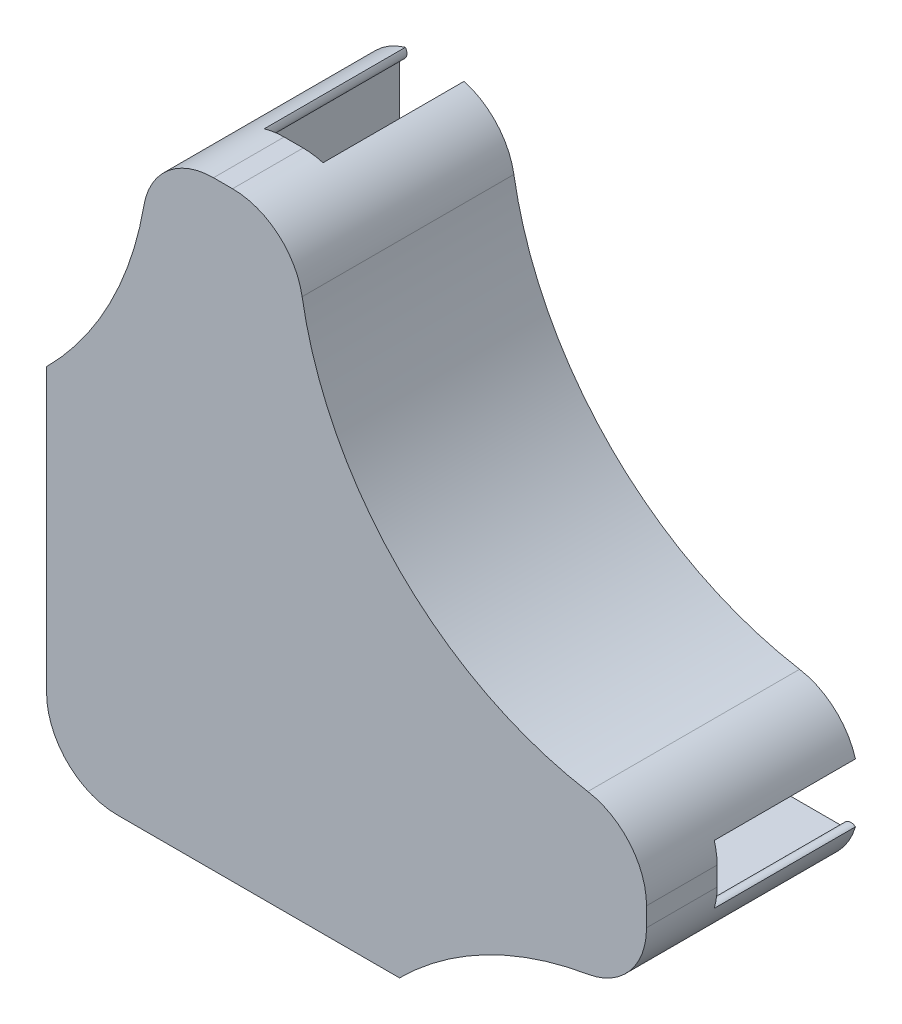
from build123d import *
from build123d.topology import SkipClean

# Parameters (mm, degrees)
BOSS_EXTRUDE1_DEPTH  = 19.05
CUT_EXTRUDE1_DEPTH   = 12.7
MIRROR2_COPY_1_DEPTH = 12.7
SKETCH6_W            = 6.35
SKETCH6_H            = 32.8168
SKETCH6_W_2          = 32.8168
SKETCH6_H_2          = 6.35
CUT_EXTRUDE2_DEPTH   = 12.7
SKETCH7_R            = 0.675
BOSS_EXTRUDE2_DEPTH  = 12.7
FILLET2_DEPTH        = 20
CUT_EXTRUDE3_DEPTH   = 12.7


with BuildPart() as part:
    # Sketch5 → Boss-Extrude1 (new body)
    with BuildSketch(Plane.XY):
        with BuildLine():
            Line((-15.875, 15.875), (-15.875, -15.875))
            Line((-15.875, -15.875), (15.875, -15.875))
            ThreePointArc((15.875, -15.875), (26.071916674, -9.061638106), (38.1, -6.669103576))
            Line((38.1, -6.669103576), (38.1, 6.669103576))
            ThreePointArc((38.1, 6.669103576), (15.875, 15.875), (6.669103576, 38.1))
            Line((6.669103576, 38.1), (-6.669103576, 38.1))
            ThreePointArc((-6.669103576, 38.1), (-9.061638106, 26.071916674), (-15.875, 15.875))
        make_face()
    extrude(amount=BOSS_EXTRUDE1_DEPTH)

    # Sketch4 → Cut-Extrude1 (cut)
    with BuildSketch(Plane.XY):
        with BuildLine():
            Line((4.190365, -12.7), (10.11729625, -12.7))
            Line((10.11729625, -12.7), (12.7, -12.7))
            Line((12.7, -12.7), (12.7, -10.11729625))
            Line((12.7, -10.11729625), (12.7, -4.190365))
            Line((12.7, -4.190365), (12.7, -2.6162))
            Line((12.7, -2.6162), (11.760835, -2.6162))
            Line((11.760835, -2.6162), (11.429365, -2.6162))
            Line((11.429365, -2.6162), (9.8552, -2.6162))
            Line((9.8552, -2.6162), (9.8552, -4.190365))
            Line((9.8552, -4.190365), (9.8552, -6.348478019))
            ThreePointArc((9.8552, -6.348478019), (9.587703162, -6.748815328), (9.115473107, -6.65488293))
            Line((9.115473107, -6.65488293), (5.748911934, -3.288321756))
            ThreePointArc((5.748911934, -3.288321756), (5.404234588, -2.772475655), (5.2832, -2.16399369))
            Line((5.2832, -2.16399369), (5.2832, 0.635))
            Line((5.2832, 0.635), (1.863267895, 0.635))
            ThreePointArc((1.863267895, 0.635), (1.391939699, -1.391939699), (-0.635, -1.863267895))
            Line((-0.635, -1.863267895), (-0.635, -5.2832))
            Line((-0.635, -5.2832), (2.16399369, -5.2832))
            ThreePointArc((2.16399369, -5.2832), (2.772475655, -5.404234588), (3.288321756, -5.748911934))
            Line((3.288321756, -5.748911934), (6.65488293, -9.115473107))
            ThreePointArc((6.65488293, -9.115473107), (6.748815328, -9.587703162), (6.348478019, -9.8552))
            Line((6.348478019, -9.8552), (4.190365, -9.8552))
            Line((4.190365, -9.8552), (2.6162, -9.8552))
            Line((2.6162, -9.8552), (2.6162, -11.429365))
            Line((2.6162, -11.429365), (2.6162, -11.760835))
            Line((2.6162, -11.760835), (2.6162, -12.7))
            Line((2.6162, -12.7), (4.190365, -12.7))
        make_face()
    cut_extrude1 = extrude(amount=CUT_EXTRUDE1_DEPTH, mode=Mode.SUBTRACT)

    # Mirror1: Cut-Extrude1 across plane
    add(cut_extrude1.mirror(Plane.ZX), mode=Mode.SUBTRACT)

    # Mirror2: Cut-Extrude1 across plane
    add(cut_extrude1.mirror(Plane(origin=(0, 0, 0), x_dir=(0, 0, 1), z_dir=(1, 0, 0))), mode=Mode.SUBTRACT)

    # Mirror2 copy 1 sketch → Mirror2 copy 1 (cut)
    with BuildSketch(Plane(origin=(0, 0, 0), x_dir=(-1, 0, 0), z_dir=(0, 0, 1))):
        with BuildLine():
            Line((4.190365, -12.7), (10.11729625, -12.7))
            Line((10.11729625, -12.7), (12.7, -12.7))
            Line((12.7, -12.7), (12.7, -10.11729625))
            Line((12.7, -10.11729625), (12.7, -4.190365))
            Line((12.7, -4.190365), (12.7, -2.6162))
            Line((12.7, -2.6162), (11.760835, -2.6162))
            Line((11.760835, -2.6162), (11.429365, -2.6162))
            Line((11.429365, -2.6162), (9.8552, -2.6162))
            Line((9.8552, -2.6162), (9.8552, -4.190365))
            Line((9.8552, -4.190365), (9.8552, -6.348478019))
            ThreePointArc((9.8552, -6.348478019), (9.587703162, -6.748815328), (9.115473107, -6.65488293))
            Line((9.115473107, -6.65488293), (5.748911934, -3.288321756))
            ThreePointArc((5.748911934, -3.288321756), (5.404234588, -2.772475655), (5.2832, -2.16399369))
            Line((5.2832, -2.16399369), (5.2832, 0.635))
            Line((5.2832, 0.635), (1.863267895, 0.635))
            ThreePointArc((1.863267895, 0.635), (1.391939699, -1.391939699), (-0.635, -1.863267895))
            Line((-0.635, -1.863267895), (-0.635, -5.2832))
            Line((-0.635, -5.2832), (2.16399369, -5.2832))
            ThreePointArc((2.16399369, -5.2832), (2.772475655, -5.404234588), (3.288321756, -5.748911934))
            Line((3.288321756, -5.748911934), (6.65488293, -9.115473107))
            ThreePointArc((6.65488293, -9.115473107), (6.748815328, -9.587703162), (6.348478019, -9.8552))
            Line((6.348478019, -9.8552), (4.190365, -9.8552))
            Line((4.190365, -9.8552), (2.6162, -9.8552))
            Line((2.6162, -9.8552), (2.6162, -11.429365))
            Line((2.6162, -11.429365), (2.6162, -11.760835))
            Line((2.6162, -11.760835), (2.6162, -12.7))
            Line((2.6162, -12.7), (4.190365, -12.7))
        make_face()
    extrude(amount=MIRROR2_COPY_1_DEPTH, mode=Mode.SUBTRACT)

    # Sketch6 → Cut-Extrude2 (cut)
    with BuildSketch(Plane(origin=(0, 0, 0), x_dir=(-1, 0, 0), z_dir=(0, 0, -1))):
        with Locations((0, 21.6916)):
            Rectangle(SKETCH6_W, SKETCH6_H)
        with Locations((-21.6916, 0)):
            Rectangle(SKETCH6_W_2, SKETCH6_H_2)
    extrude(amount=-CUT_EXTRUDE2_DEPTH, mode=Mode.SUBTRACT)

    # Sketch7 → Boss-Extrude2 (add)
    with SkipClean():  # the faces are left unmerged after this step: merging them gives an invalid solid
        with BuildSketch(Plane(origin=(0, 0, 0), x_dir=(-1, 0, 0), z_dir=(0, 0, -1))):
            with Locations((-37.425, 3.175)):
                Circle(SKETCH7_R)
            with Locations((-13.375, 3.175)):
                Circle(SKETCH7_R)
            with Locations((-13.375, -3.175)):
                Circle(SKETCH7_R)
            with Locations((-37.425, -3.175)):
                Circle(SKETCH7_R)
            with Locations((-3.175, 13.375)):
                Circle(SKETCH7_R)
            with Locations((3.175, 13.375)):
                Circle(SKETCH7_R)
            with Locations((-3.175, 37.425)):
                Circle(SKETCH7_R)
            with Locations((3.175, 37.425)):
                Circle(SKETCH7_R)
            with Locations((-25.4, 3.175)):
                Circle(SKETCH7_R)
            with Locations((-25.4, -3.175)):
                Circle(SKETCH7_R)
            with Locations((-3.175, 25.4)):
                Circle(SKETCH7_R)
            with Locations((3.175, 25.4)):
                Circle(SKETCH7_R)
        extrude(amount=-BOSS_EXTRUDE2_DEPTH)

    # Fillet2: read off the stored shape, not the designer's step
    # Fillet2 outline → Fillet2 (cut)
    with SkipClean():  # the faces are left unmerged after this step: merging them gives an invalid solid
        with BuildSketch(Plane.XY):
            with BuildLine():
                Line((-15.875, -15.875), (-9.525, -15.875))
                ThreePointArc((-9.525, -15.875), (-14.015128061, -14.015128061), (-15.875, -9.525))
                Line((-15.875, -9.525), (-15.875, -15.875))
            make_face()
            with BuildLine():
                ThreePointArc((32.817272188, -7.11622946), (35.449191883, -6.781084528), (38.1, -6.669103576))
                Line((38.1, -6.669103576), (38.1, -0.85656253))
                ThreePointArc((38.1, -0.85656253), (36.602817656, -4.952006438), (32.817272188, -7.11622946))
            make_face()
            with BuildLine():
                ThreePointArc((-6.669103576, 38.1), (-6.781084528, 35.449191883), (-7.11622946, 32.817272188))
                ThreePointArc((-7.11622946, 32.817272188), (-4.952006438, 36.602817656), (-0.85656253, 38.1))
                Line((-0.85656253, 38.1), (-6.669103576, 38.1))
            make_face()
            with BuildLine():
                Line((38.1, 0.85656253), (38.1, 6.669103576))
                ThreePointArc((38.1, 6.669103576), (35.449191883, 6.781084528), (32.817272188, 7.11622946))
                ThreePointArc((32.817272188, 7.11622946), (36.602817656, 4.952006438), (38.1, 0.85656253))
            make_face()
            with BuildLine():
                ThreePointArc((0.85656253, 38.1), (4.952006438, 36.602817656), (7.11622946, 32.817272188))
                ThreePointArc((7.11622946, 32.817272188), (6.781084528, 35.449191883), (6.669103576, 38.1))
                Line((6.669103576, 38.1), (0.85656253, 38.1))
            make_face()
        extrude(amount=FILLET2_DEPTH, mode=Mode.SUBTRACT)

    # Sketch8 → Cut-Extrude3 (cut)
    with SkipClean():  # the faces are left unmerged after this step: merging them gives an invalid solid
        with BuildSketch(Plane(origin=(0, 0, 0), x_dir=(-1, 0, 0), z_dir=(0, 0, -1))):
            Polygon((-11.115734746, 10.664446616), (-11.115734746, -10.290263943), (-3.470097109, -3.989692187), (-3.470097109, 3.514359567), (3.609196999, 3.514359567), (10.051354637, 10.664446616), align=None)
        extrude(amount=-CUT_EXTRUDE3_DEPTH, mode=Mode.SUBTRACT)


solid = part.part
